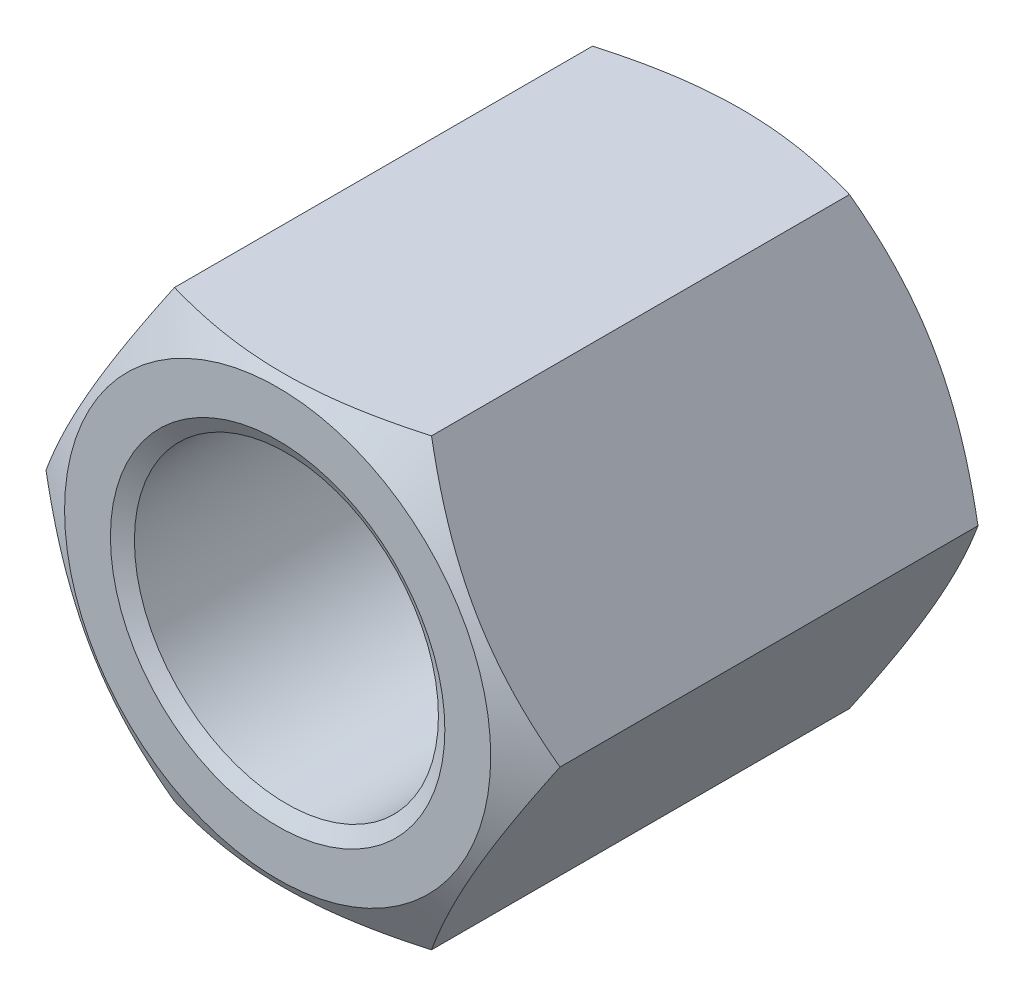
from build123d import *
from OCP.BRepFilletAPI import BRepFilletAPI_MakeChamfer

# Parameters (mm, degrees)
SKETCH1_R        = 6
BASENUT_DEPTH    = 18.5
ENDCHAMFER_SIZE  = 0.6
ENDCHAMFER_SIZE2 = 0.346410162


with BuildPart() as part:
    # Sketch1 → BaseNut (new body)
    with BuildSketch(Plane.XY):
        Polygon((5.072022115, -8.785), (10.14404423, 0), (5.072022115, 8.785), (-5.072022115, 8.785), (-10.14404423, 0), (-5.072022115, -8.785), align=None)
        Circle(SKETCH1_R, mode=Mode.SUBTRACT)
    extrude(amount=-BASENUT_DEPTH)

    # Sketch2 → Double-Chamfer (revolve, cut)
    with BuildSketch(Plane(origin=(0, 0, 0), x_dir=(1, 0, 0), z_dir=(0, 1, 0))):
        Polygon((-10.14404423, 18.5), (-8.41, 18.5), (-10.14404423, 17.498849097), align=None)
        Polygon((-10.14404423, 1.001150903), (-10.14404423, 0), (-8.41, 0), align=None)
    revolve(axis=Axis((0, 0, -3.375940562), (0, 0, 1)), mode=Mode.SUBTRACT)

    # EndChamfer: one chamfer whose edges measure the first distance from different faces: ONE call of the kernel's chamfer builder (chamfer() names one face for all edges)
    endchamfer_edges_1 = [part.edges().sort_by_distance(p)[0] for p in [
        (-6, 0, 0),
    ]]
    endchamfer_side_1 = [part.faces().sort_by_distance(p)[0] for p in [
        (8.172129279, 0, 0),
    ]]
    endchamfer_edges_2 = [part.edges().sort_by_distance(p)[0] for p in [
        (-6, 0, -18.5),
    ]]
    endchamfer_side_2 = [part.faces().sort_by_distance(p)[0] for p in [
        (-6, 0, -9.25),
    ]]
    endchamfer = BRepFilletAPI_MakeChamfer(part.part.solid().wrapped)
    for e in endchamfer_edges_1:
        endchamfer.Add(ENDCHAMFER_SIZE, ENDCHAMFER_SIZE2, e.wrapped, endchamfer_side_1[0].wrapped)  # the first distance lies on this face
    for e in endchamfer_edges_2:
        endchamfer.Add(ENDCHAMFER_SIZE, ENDCHAMFER_SIZE2, e.wrapped, endchamfer_side_2[0].wrapped)  # the first distance lies on this face
    add(Compound.cast(endchamfer.Shape()), mode=Mode.REPLACE)


solid = part.part
